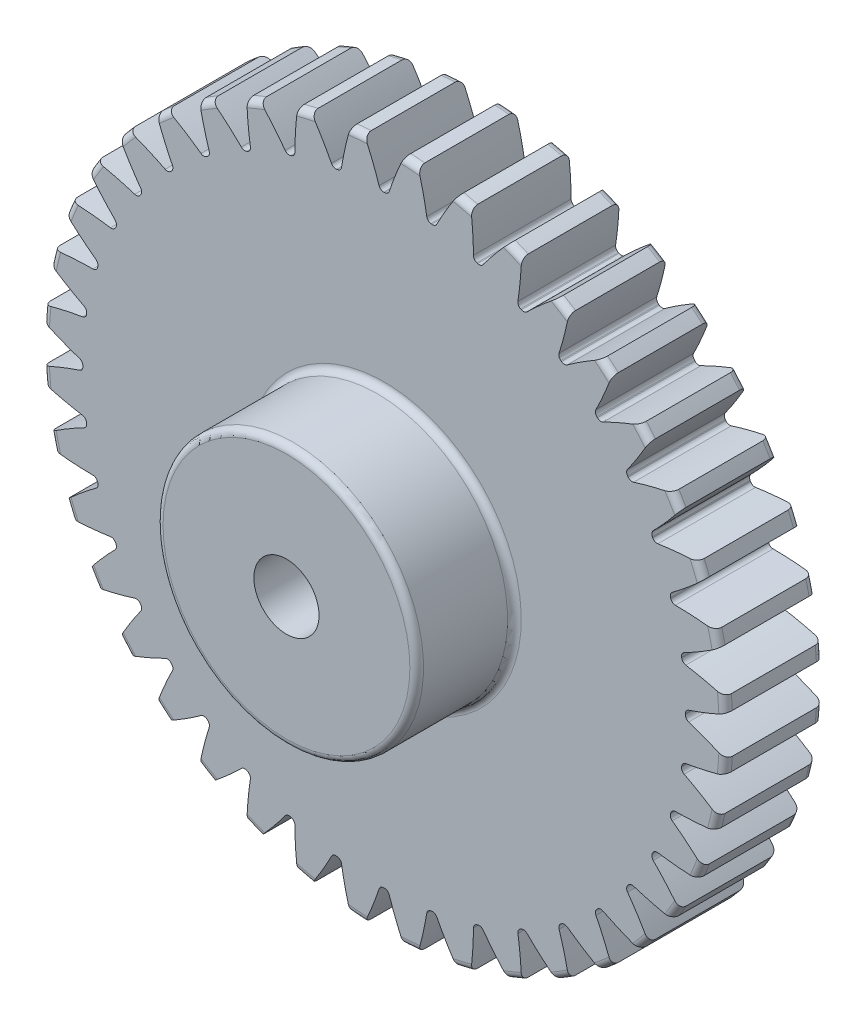
from build123d import *

# Parameters (mm, degrees)
FILLET2_R           = 0.42
CUT_EXTRUDE2_DEPTH  = 31.298514884
CIRPATTERN1_COUNT   = 40
BOSS_EXTRUDE1_START = -12
SKETCH8_R           = 4
SKETCH8_R_2         = 2
BOSS_EXTRUDE1_DEPTH = 12


with BuildPart() as part:
    # Sketch4 → Revolve1 (revolve)
    with BuildSketch(Plane(origin=(0, 0, 0), x_dir=(0, 0, -1), z_dir=(1, 0, 0))):
        Polygon((-12, 4), (-12, 8), (-6, 8), (-6, 21), (0, 21), (0, 4), align=None)
    revolve(axis=Axis((0, 0, 6), (0, 0, 1)))

    # Fillet2
    fillet2_edges = [part.edges().sort_by_distance(p)[0] for p in [
        (0, -21, 0),
        (0, -21, 6),
        (0, -8, 6),
        (0, -8, 12),
    ]]
    fillet(fillet2_edges, radius=FILLET2_R)

    # Sketch7 → Cut-Extrude2 (cut, through all)
    with BuildSketch(Plane.XY.offset(6)):
        with BuildLine():
            ThreePointArc((-0.026958983, 18.499980357), (0, 18.5), (0.026958983, 18.499980357))
            ThreePointArc((0.026958983, 18.499980357), (0.202840783, 18.556625013), (0.312174396, 18.705585364))
            ThreePointArc((0.312174396, 18.705585364), (0.730273565, 19.848918998), (1.21715964, 20.96469705))
            ThreePointArc((1.21715964, 20.96469705), (0, 21), (-1.21715964, 20.96469705))
            ThreePointArc((-1.21715964, 20.96469705), (-0.730273565, 19.848918998), (-0.312174396, 18.705585364))
            ThreePointArc((-0.312174396, 18.705585364), (-0.202840783, 18.556625013), (-0.026958983, 18.499980357))
        make_face()
    cut_extrude2 = extrude(amount=-CUT_EXTRUDE2_DEPTH, mode=Mode.SUBTRACT)

    # CirPattern1: Cut-Extrude2 ×40 about axis
    cirpattern1_axis = Axis((0, 0, 0), (0, 0, 1))
    for i in range(1, CIRPATTERN1_COUNT):
        add(cut_extrude2.rotate(cirpattern1_axis, i * 360 / CIRPATTERN1_COUNT), mode=Mode.SUBTRACT)

    # Sketch8 → Boss-Extrude1 (add)
    with BuildSketch(Plane(origin=(0, 0, 0), x_dir=(-1, 0, 0), z_dir=(0, 0, -1)).offset(BOSS_EXTRUDE1_START)):
        Circle(SKETCH8_R)
        with Locations(Location((0, 0, 0), (0, 0, 90))):
            Circle(SKETCH8_R_2, mode=Mode.SUBTRACT)
    extrude(amount=BOSS_EXTRUDE1_DEPTH)


solid = part.part
